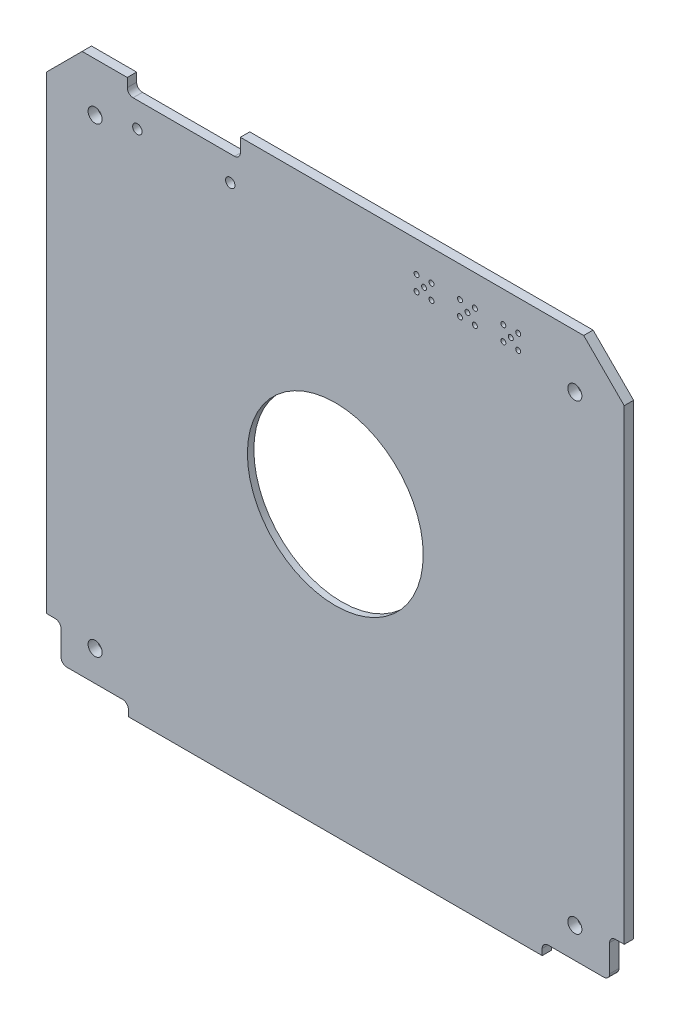
from build123d import *

# Parameters (mm, degrees)
SKETCH1_W             = 98.6
SKETCH1_H             = 95.18
BOSS_EXTRUDE1_DEPTH   = 1.6
HOLE1_D               = 0.85
HOLE2_D               = 0.85
HOLE3_D               = 0.85
HOLE4_D               = 0.85
HOLE5_D               = 0.85
HOLE6_D               = 0.85
HOLE7_D               = 0.85
HOLE8_D               = 0.85
HOLE9_D               = 0.85
HOLE10_D              = 0.85
HOLE11_D              = 0.85
HOLE12_D              = 0.85
HOLE13_D              = 0.85
HOLE14_D              = 0.85
HOLE15_D              = 0.85
HOLE16_D              = 1.6
HOLE17_D              = 1.6
F_2_CLEARANCE_HOLE1_D = 2.4
F_2_CLEARANCE_HOLE2_D = 2.4
F_2_CLEARANCE_HOLE3_D = 2.4
F_2_CLEARANCE_HOLE4_D = 2.4
CUT_EXTRUDE1_REACH    = 71.563
SKETCH44_R            = 38.5
HOLE18_D              = 30
HOLE18_DEPTH          = 1.6
CUT_EXTRUDE2_REACH    = 107.373
SKETCH47_W            = 14
SKETCH47_H            = 1.6
CUT_EXTRUDE3_REACH    = 109.912
SKETCH48_W            = 6.6
SKETCH48_H            = 1.6
CUT_EXTRUDE4_REACH    = 109.912
SKETCH49_W            = 1.6
SKETCH49_H            = 8.265
CUT_EXTRUDE5_REACH    = 107.373
SKETCH50_W            = 11.5
SKETCH50_H            = 1.6
CUT_EXTRUDE6_REACH    = 108.479
SKETCH51_W            = 33.099999986
SKETCH51_H            = 1.6
CUT_EXTRUDE7_REACH    = 106.27
SKETCH52_W            = 19.300000003
SKETCH52_H            = 1.6
CHAMFER1_SIZE         = 6.915
CHAMFER2_SIZE         = 6.1
FILLET1_R             = 1


with BuildPart() as part:
    # Sketch1 → Boss-Extrude1 (new body)
    with BuildSketch(Plane(origin=(0, 0, -0.0125), x_dir=(-1, 0, 0), z_dir=(0, 0, -1))):
        with Locations((0, -1.475)):
            Rectangle(SKETCH1_W, SKETCH1_H)
    extrude(amount=-BOSS_EXTRUDE1_DEPTH)

    # Hole1 (through all)
    with Locations(Plane(origin=(0, 0, -0.0125), x_dir=(-1, 0, 0), z_dir=(0, 0, -1))):
        with Locations((-31.21, 40.87)):
            Hole(HOLE1_D / 2)

    # Hole2 (through all)
    with Locations(Plane(origin=(0, 0, -0.0125), x_dir=(-1, 0, 0), z_dir=(0, 0, -1))):
        with Locations((-28.67, 40.87)):
            Hole(HOLE2_D / 2)

    # Hole3 (through all)
    with Locations(Plane(origin=(0, 0, -0.0125), x_dir=(-1, 0, 0), z_dir=(0, 0, -1))):
        with Locations((-29.94, 39.6)):
            Hole(HOLE3_D / 2)

    # Hole4 (through all)
    with Locations(Plane(origin=(0, 0, -0.0125), x_dir=(-1, 0, 0), z_dir=(0, 0, -1))):
        with Locations((-31.21, 38.33)):
            Hole(HOLE4_D / 2)

    # Hole5 (through all)
    with Locations(Plane(origin=(0, 0, -0.0125), x_dir=(-1, 0, 0), z_dir=(0, 0, -1))):
        with Locations((-28.67, 38.33)):
            Hole(HOLE5_D / 2)

    # Hole6 (through all)
    with Locations(Plane(origin=(0, 0, -0.0125), x_dir=(-1, 0, 0), z_dir=(0, 0, -1))):
        with Locations((-23.81, 40.87)):
            Hole(HOLE6_D / 2)

    # Hole7 (through all)
    with Locations(Plane(origin=(0, 0, -0.0125), x_dir=(-1, 0, 0), z_dir=(0, 0, -1))):
        with Locations((-21.27, 40.87)):
            Hole(HOLE7_D / 2)

    # Hole8 (through all)
    with Locations(Plane(origin=(0, 0, -0.0125), x_dir=(-1, 0, 0), z_dir=(0, 0, -1))):
        with Locations((-22.54, 39.6)):
            Hole(HOLE8_D / 2)

    # Hole9 (through all)
    with Locations(Plane(origin=(0, 0, -0.0125), x_dir=(-1, 0, 0), z_dir=(0, 0, -1))):
        with Locations((-23.81, 38.33)):
            Hole(HOLE9_D / 2)

    # Hole10 (through all)
    with Locations(Plane(origin=(0, 0, -0.0125), x_dir=(-1, 0, 0), z_dir=(0, 0, -1))):
        with Locations((-21.27, 38.33)):
            Hole(HOLE10_D / 2)

    # Hole11 (through all)
    with Locations(Plane(origin=(0, 0, -0.0125), x_dir=(-1, 0, 0), z_dir=(0, 0, -1))):
        with Locations((-16.41, 40.87)):
            Hole(HOLE11_D / 2)

    # Hole12 (through all)
    with Locations(Plane(origin=(0, 0, -0.0125), x_dir=(-1, 0, 0), z_dir=(0, 0, -1))):
        with Locations((-13.87, 40.87)):
            Hole(HOLE12_D / 2)

    # Hole13 (through all)
    with Locations(Plane(origin=(0, 0, -0.0125), x_dir=(-1, 0, 0), z_dir=(0, 0, -1))):
        with Locations((-15.14, 39.6)):
            Hole(HOLE13_D / 2)

    # Hole14 (through all)
    with Locations(Plane(origin=(0, 0, -0.0125), x_dir=(-1, 0, 0), z_dir=(0, 0, -1))):
        with Locations((-16.41, 38.33)):
            Hole(HOLE14_D / 2)

    # Hole15 (through all)
    with Locations(Plane(origin=(0, 0, -0.0125), x_dir=(-1, 0, 0), z_dir=(0, 0, -1))):
        with Locations((-13.87, 38.33)):
            Hole(HOLE15_D / 2)

    # Hole16 (through all)
    with Locations(Plane(origin=(0, 0, -0.0125), x_dir=(-1, 0, 0), z_dir=(0, 0, -1))):
        with Locations((17.925000017, 38.540000432)):
            Hole(HOLE16_D / 2)

    # Hole17 (through all)
    with Locations(Plane(origin=(0, 0, -0.0125), x_dir=(-1, 0, 0), z_dir=(0, 0, -1))):
        with Locations((33.775000017, 38.540000432)):
            Hole(HOLE17_D / 2)

    # #2 Clearance Hole1 (through all)
    with Locations(Plane(origin=(0, 0, -0.0125), x_dir=(-1, 0, 0), z_dir=(0, 0, -1))):
        with Locations((40.986176345, 36.992583135)):
            Hole(F_2_CLEARANCE_HOLE1_D / 2)

    # #2 Clearance Hole2 (through all)
    with Locations(Plane(origin=(0, 0, -0.0125), x_dir=(-1, 0, 0), z_dir=(0, 0, -1))):
        with Locations((-40.872805953, 36.992583135)):
            Hole(F_2_CLEARANCE_HOLE2_D / 2)

    # #2 Clearance Hole3 (through all)
    with Locations(Plane(origin=(0, 0, -0.0125), x_dir=(-1, 0, 0), z_dir=(0, 0, -1))):
        with Locations((-40.872805953, -41.802159184)):
            Hole(F_2_CLEARANCE_HOLE3_D / 2)

    # #2 Clearance Hole4 (through all)
    with Locations(Plane(origin=(0, 0, -0.0125), x_dir=(-1, 0, 0), z_dir=(0, 0, -1))):
        with Locations((40.986176345, -41.802159184)):
            Hole(F_2_CLEARANCE_HOLE4_D / 2)

    # Sketch44 → Cut-Extrude1 (cut, up to next)
    with BuildSketch(Plane.XY.offset(0.4875), mode=Mode.PRIVATE) as cut_extrude1_sk1:
        Circle(SKETCH44_R)
    cut_extrude1_tool1 = extrude(cut_extrude1_sk1.sketch, amount=-CUT_EXTRUDE1_REACH, mode=Mode.PRIVATE) & part.part
    add(cut_extrude1_tool1.solids().sort_by_distance((0, 0, 0.4875))[0], mode=Mode.SUBTRACT)

    # Hole18
    with Locations(Plane.XY.offset(1.5875)):
        with Locations((0, 0)):
            Hole(HOLE18_D / 2, depth=HOLE18_DEPTH)

    # Sketch47 → Cut-Extrude2 (cut, up to next)
    with BuildSketch(Plane(origin=(0, -47, 0), x_dir=(1, 0, 0), z_dir=(0, 1, 0)), mode=Mode.PRIVATE) as cut_extrude2_sk1:
        with Locations((42.3, -0.7875)):
            Rectangle(SKETCH47_W, SKETCH47_H)
    cut_extrude2_tool1 = extrude(cut_extrude2_sk1.sketch, amount=-CUT_EXTRUDE2_REACH, mode=Mode.PRIVATE) & part.part
    add(cut_extrude2_tool1.solids().sort_by_distance((42.3, -47, 0.7875))[0], mode=Mode.SUBTRACT)

    # Sketch48 → Cut-Extrude3 (cut, up to next)
    with BuildSketch(Plane(origin=(46.8, 0, 0), x_dir=(0, -1, 0), z_dir=(-1, 0, 0)), mode=Mode.PRIVATE) as cut_extrude3_sk1:
        with Locations((43.7, 0.7875)):
            Rectangle(SKETCH48_W, SKETCH48_H)
    cut_extrude3_tool1 = extrude(cut_extrude3_sk1.sketch, amount=-CUT_EXTRUDE3_REACH, mode=Mode.PRIVATE) & part.part
    add(cut_extrude3_tool1.solids().sort_by_distance((46.8, -43.7, 0.7875))[0], mode=Mode.SUBTRACT)

    # Sketch49 → Cut-Extrude4 (cut, up to next)
    with BuildSketch(Plane(origin=(-46.8, 0, 0), x_dir=(0, 0, -1), z_dir=(1, 0, 0)), mode=Mode.PRIVATE) as cut_extrude4_sk1:
        with Locations((-0.7875, -44.9325)):
            Rectangle(SKETCH49_W, SKETCH49_H)
    cut_extrude4_tool1 = extrude(cut_extrude4_sk1.sketch, amount=-CUT_EXTRUDE4_REACH, mode=Mode.PRIVATE) & part.part
    add(cut_extrude4_tool1.solids().sort_by_distance((-46.8, -44.9325, 0.7875))[0], mode=Mode.SUBTRACT)

    # Sketch50 → Cut-Extrude5 (cut, up to next)
    with BuildSketch(Plane(origin=(0, -47, 0), x_dir=(1, 0, 0), z_dir=(0, 1, 0)), mode=Mode.PRIVATE) as cut_extrude5_sk1:
        with Locations((-41.05, -0.7875)):
            Rectangle(SKETCH50_W, SKETCH50_H)
    cut_extrude5_tool1 = extrude(cut_extrude5_sk1.sketch, amount=-CUT_EXTRUDE5_REACH, mode=Mode.PRIVATE) & part.part
    add(cut_extrude5_tool1.solids().sort_by_distance((-41.05, -47, 0.7875))[0], mode=Mode.SUBTRACT)

    # Sketch51 → Cut-Extrude6 (cut, up to next)
    with BuildSketch(Plane.XZ.offset(-45.3), mode=Mode.PRIVATE) as cut_extrude6_sk1:
        with Locations((-32.750000007, 0.7875)):
            Rectangle(SKETCH51_W, SKETCH51_H)
    cut_extrude6_tool1 = extrude(cut_extrude6_sk1.sketch, amount=-CUT_EXTRUDE6_REACH, mode=Mode.PRIVATE) & part.part
    add(cut_extrude6_tool1.solids().sort_by_distance((-32.75, 45.3, 0.7875))[0], mode=Mode.SUBTRACT)

    # Sketch52 → Cut-Extrude7 (cut, up to next)
    with BuildSketch(Plane.XZ.offset(-42.8), mode=Mode.PRIVATE) as cut_extrude7_sk1:
        with Locations((-25.850000016, 0.7875)):
            Rectangle(SKETCH52_W, SKETCH52_H)
    cut_extrude7_tool1 = extrude(cut_extrude7_sk1.sketch, amount=-CUT_EXTRUDE7_REACH, mode=Mode.PRIVATE) & part.part
    add(cut_extrude7_tool1.solids().sort_by_distance((-25.85, 42.8, 0.7875))[0], mode=Mode.SUBTRACT)

    # Chamfer1
    chamfer1_edges = [part.edges().sort_by_distance(p)[0] for p in [
        (49.3, 46.115, 0.7875),
    ]]
    chamfer(chamfer1_edges, length=CHAMFER1_SIZE)

    # Chamfer2
    chamfer2_edges = [part.edges().sort_by_distance(p)[0] for p in [
        (-49.3, 45.3, 0.7875),
    ]]
    chamfer(chamfer2_edges, length=CHAMFER2_SIZE)

    # Fillet1
    fillet1_edges = [part.edges().sort_by_distance(p)[0] for p in [
        (35.3, -47, 0.7875),
        (-46.8, -40.8, 0.7875),
        (-35.3, -47, 0.7875),
        (-16.200000014, 42.8, 0.7875),
        (-46.8, -47, 0.7875),
        (46.8, -47, 0.7875),
        (46.8, -40.4, 0.7875),
        (-35.500000017, 42.8, 0.7875),
    ]]
    fillet(fillet1_edges, radius=FILLET1_R)


solid = part.part
